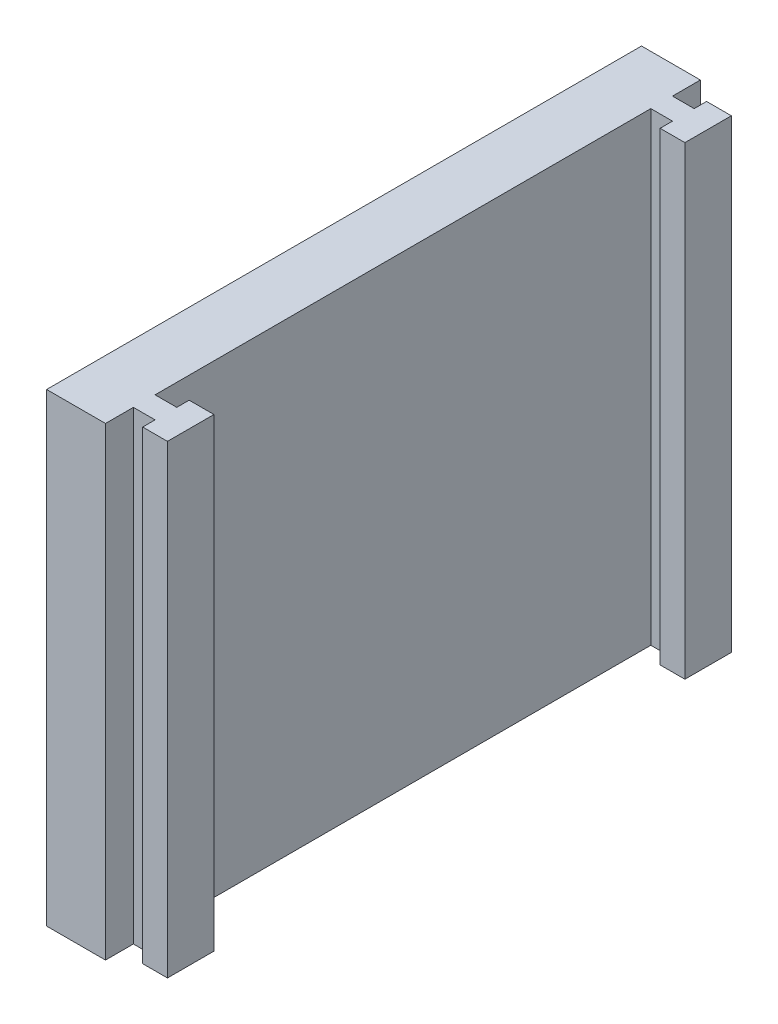
from build123d import *

# Parameters (mm, degrees)
ESTRUSIONE_ESTRUSIONE1_DEPTH = 150
TAGLIO_ESTRUSIONE1_DEPTH     = 30


with BuildPart() as part:
    # Schizzo2 → Estrusione-Estrusione1 (new body)
    with BuildSketch(Plane(origin=(0, 0, 0), x_dir=(1, 0, 0), z_dir=(0, 1, 0))):
        Polygon((19, 96), (19, 87), (26, 87), (26, 91), (34, 91), (34, 76), (26, 76), (26, 80), (19, 80), (19, 0), (0, 0), (0, 96), align=None)
    extrude(amount=ESTRUSIONE_ESTRUSIONE1_DEPTH)

    # Schizzo3 → Taglio-Estrusione1 (cut)
    with BuildSketch(Plane.XZ):
        with BuildLine():
            Line((9.783882181, -91), (5, -91))
            Line((5, -91), (5, -76))
            Line((5, -76), (9.783882181, -76))
            ThreePointArc((9.783882181, -76), (15, -83.5), (9.783882181, -91))
        make_face()
    extrude(amount=-TAGLIO_ESTRUSIONE1_DEPTH, mode=Mode.SUBTRACT)

    # Specchia2: part across plane


with BuildPart() as part_1:
    add(part.part)
    add(part.part.mirror(Plane(origin=(19, 150, 0), x_dir=(1, 0, 0), z_dir=(0, 0, -1))))


solid = part_1.part
